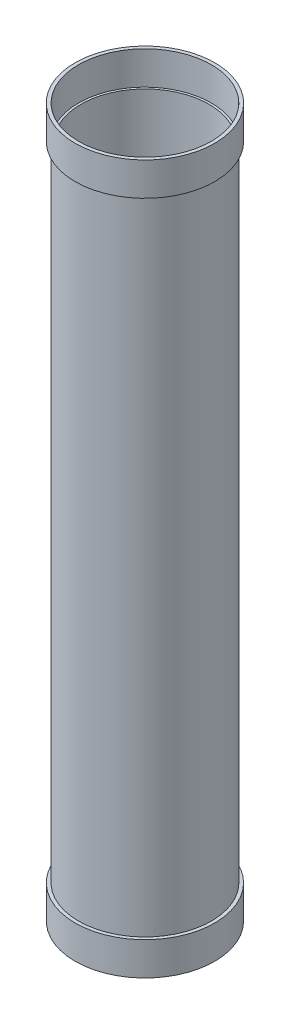
from build123d import *

# Parameters (mm, degrees)
SKETCH1_R                 = 30
SKETCH1_R_2               = 29
BOSS_EXTRUDE2_DEPTH       = 290
SKETCH2_R                 = 31.5
SKETCH2_R_2               = 30
BOSS_EXTRUDE3_DEPTH       = 15
BOSS_EXTRUDE4_START       = 290
BOSS_EXTRUDE4_OUTLINE_R   = 31.530256187
BOSS_EXTRUDE4_OUTLINE_R_2 = 30
BOSS_EXTRUDE4_DEPTH       = 15


# Read off the part's stored shape, not the designer's step: Boss-Extrude4
with BuildPart() as part:
    # Sketch1 → Boss-Extrude2 (new body)
    with BuildSketch(Plane(origin=(0, 0, 0), x_dir=(1, 0, 0), z_dir=(0, 1, 0))):
        with Locations(Location((0, 0, 0), (0, 0, 270))):
            Circle(SKETCH1_R)
        with Locations(Location((0, 0, 0), (0, 0, 270))):
            Circle(SKETCH1_R_2, mode=Mode.SUBTRACT)
    extrude(amount=BOSS_EXTRUDE2_DEPTH)


with BuildPart() as body_2:
    # Sketch2 → Boss-Extrude3 (new body)
    with BuildSketch(Plane(origin=(0, 0, 0), x_dir=(1, 0, 0), z_dir=(0, 1, 0))):
        with Locations(Location((0, 0, 0), (0, 0, 270))):
            Circle(SKETCH2_R)
        with Locations(Location((0, 0, 0), (0, 0, 270))):
            Circle(SKETCH2_R_2, mode=Mode.SUBTRACT)
    extrude(amount=-BOSS_EXTRUDE3_DEPTH)


with BuildPart() as body_3:
    # Boss-Extrude4 outline → Boss-Extrude4 (new body)
    with BuildSketch(Plane(origin=(0, 0, 0), x_dir=(1, 0, 0), z_dir=(0, 1, 0)).offset(BOSS_EXTRUDE4_START)):
        Circle(BOSS_EXTRUDE4_OUTLINE_R)
        Circle(BOSS_EXTRUDE4_OUTLINE_R_2, mode=Mode.SUBTRACT)
    extrude(amount=BOSS_EXTRUDE4_DEPTH)


solid = Compound([part.part, body_2.part, body_3.part])
